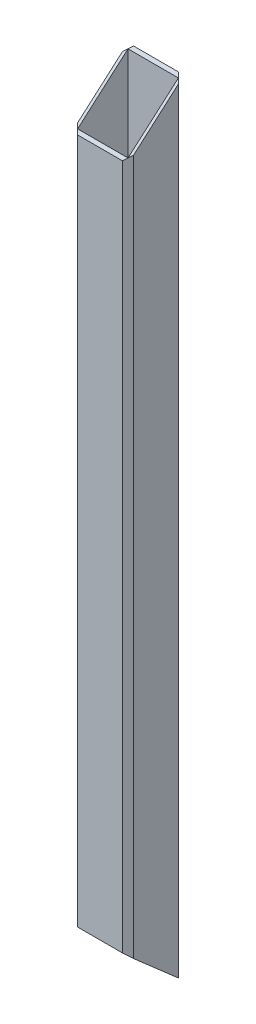
from build123d import *

# Parameters (mm, degrees)
SKETCH1_W           = 50
SKETCH1_H           = 700
BOSS_EXTRUDE1_DEPTH = 50
SKETCH2_W           = 45
SKETCH2_H           = 45
CUT_EXTRUDE1_DEPTH  = 704.562363974
CUT_EXTRUDE2_DEPTH  = 704.562363974
CHAMFER1_SIZE       = 5


with BuildPart() as part:
    # Sketch1 → Boss-Extrude1 (new body)
    with BuildSketch(Plane.XY):
        with Locations((25, 350)):
            Rectangle(SKETCH1_W, SKETCH1_H)
    extrude(amount=BOSS_EXTRUDE1_DEPTH)

    # Sketch2 → Cut-Extrude1 (cut, through all)
    with BuildSketch(Plane(origin=(0, 700, 0), x_dir=(1, 0, 0), z_dir=(0, 1, 0))):
        with Locations((25, -25)):
            Rectangle(SKETCH2_W, SKETCH2_H)
    extrude(amount=-CUT_EXTRUDE1_DEPTH, mode=Mode.SUBTRACT)

    # Sketch3 → Cut-Extrude2 (cut, through all)
    with BuildSketch(Plane.ZY):
        Polygon((0, 700), (50, 700), (50, 656.25), align=None)
        Polygon((0, 0), (50, 0), (50, 43.75), align=None)
    extrude(amount=-CUT_EXTRUDE2_DEPTH, mode=Mode.SUBTRACT)

    # Chamfer1
    chamfer1_edges = [part.edges().sort_by_distance(p)[0] for p in [
        (0, 350, 50),
        (50, 350, 50),
        (0, 350, 0),
        (50, 350, 0),
    ]]
    chamfer(chamfer1_edges, length=CHAMFER1_SIZE - 0.0001)  # a hair under: the kernel refuses the full size


solid = part.part
